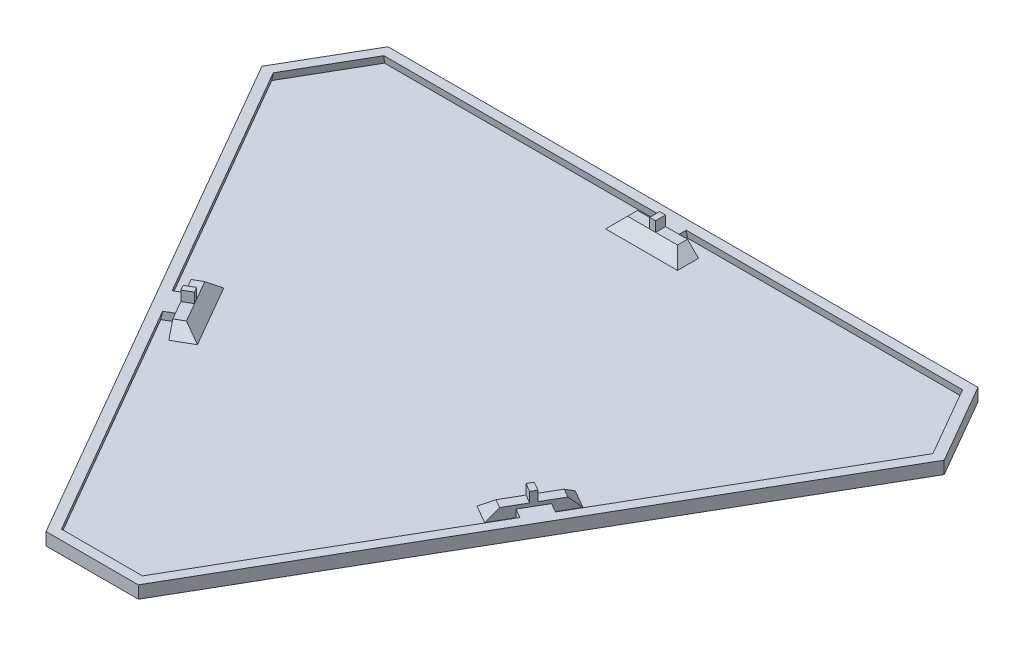
from build123d import *

# Parameters (mm, degrees)
BOSS_EXTRU_2_DEPTH              = 1
EXTRU_MINCE1_DEPTH              = 1.5
EXTRU_MINCE1_DRAFT              = -10
ENL_V_DE_MAT_EXTRU_MINCE1_DEPTH = 101.734373448
ESQUISSE7_W                     = 5.2
ESQUISSE7_H                     = 4.1
BOSS_EXTRU_5_DEPTH              = 1.5
ESQUISSE8_W                     = 10
ESQUISSE8_H                     = 2
BOSS_EXTRU_6_DEPTH              = 2.2
CHANFREIN1_SIZE                 = 2.2
ESQUISSE9_W                     = 1.2
ESQUISSE9_H                     = 2
BOSS_EXTRU_7_DEPTH              = 2


with BuildPart() as part:
    # Esquisse2 → Boss.-Extru.2 (new body)
    with BuildSketch(Plane(origin=(0, 0, 0), x_dir=(1, 0, 0), z_dir=(0, 1, 0))):
        Polygon((-68.262395693, 28.744645862), (-59.024791386, 44.744645862), (59.024791386, 44.744645862), (68.262395693, 28.744645862), (9.237604307, -73.489291724), (-9.237604307, -73.489291724), align=None)
    extrude(amount=BOSS_EXTRU_2_DEPTH)


with BuildPart() as extru_mince1_tool:
    # Esquisse5 → Extru.-Mince1 (with draft: the straight prism first)
    with BuildSketch(Plane(origin=(0, 1, 0), x_dir=(1, 0, 0), z_dir=(0, 1, 0))):
        Polygon((-68.262395693, 28.744645862), (-9.237604307, -73.489291724), (9.237604307, -73.489291724), (68.262395693, 28.744645862), (59.024791386, 44.744645862), (-59.024791386, 44.744645862), align=None)
        Polygon((-66.299404778, 28.744645862), (-8.256108849, -71.789291724), (8.256108849, -71.789291724), (66.299404778, 28.744645862), (58.043295928, 43.044645862), (-58.043295928, 43.044645862), align=None, mode=Mode.SUBTRACT)
    extrude(amount=EXTRU_MINCE1_DEPTH)
    # Extru.-Mince1: the draft: its side faces are tilted about the plane it starts from
    extru_mince1_sides = [extru_mince1_tool.faces().sort_by_distance(p)[0] for p in [
        (-38.75, 1.75, 22.372322931),
        (0, 1.75, 73.489291724),
        (38.75, 1.75, 22.372322931),
        (63.643593539, 1.75, -36.744645862),
        (0, 1.75, -44.744645862),
        (-63.643593539, 1.75, -36.744645862),
        (-62.171350353, 1.75, -35.894645862),
        (0, 1.75, -43.044645862),
        (62.171350353, 1.75, -35.894645862),
        (37.277756814, 1.75, 21.522322931),
        (0, 1.75, 71.789291724),
        (-37.277756814, 1.75, 21.522322931),
    ]]
    draft(extru_mince1_sides, Plane(origin=(0, 1, 0), x_dir=(1, 0, 0), z_dir=(0, 1, 0)), EXTRU_MINCE1_DRAFT)


with BuildPart() as part_1:
    add(part.part)

    # Extru.-Mince1: add extru_mince1_tool
    add(extru_mince1_tool.part)

    # Esquisse6 → Enlèv. de mat.-Extru.-Mince1 (cut, through all)
    with BuildSketch(Plane.XZ):
        Polygon((-59.89081679, -46.244645862), (59.89081679, -46.244645862), (69.994446501, -28.744645862), (10.103629711, 74.989291724), (-10.103629711, 74.989291724), (-69.994446501, -28.744645862), align=None)
        Polygon((-59.024791386, -44.744645862), (59.024791386, -44.744645862), (68.262395693, -28.744645862), (9.237604307, 73.489291724), (-9.237604307, 73.489291724), (-68.262395693, -28.744645862), align=None, mode=Mode.SUBTRACT)
    extrude(amount=-ENL_V_DE_MAT_EXTRU_MINCE1_DEPTH, mode=Mode.SUBTRACT)

    # Esquisse7 → Boss.-Extru.5 (add)
    with BuildSketch(Plane(origin=(0, 1, 0), x_dir=(1, 0, 0), z_dir=(0, 1, 0))):
        with Locations((0, 42.694645862)):
            Rectangle(ESQUISSE7_W, ESQUISSE7_H)
        Polygon((33.899295844, -22.573988981), (36.499295844, -18.070656881), (40.05, -20.120656881), (37.45, -24.623988981), align=None)
        Polygon((-36.499295844, -18.070656881), (-33.899295844, -22.573988981), (-37.45, -24.623988981), (-40.05, -20.120656881), align=None)
    extrude(amount=BOSS_EXTRU_5_DEPTH)

    # Esquisse8 → Boss.-Extru.6 (add)
    with BuildSketch(Plane(origin=(0, 1, 0), x_dir=(1, 0, 0), z_dir=(0, 1, 0))):
        with Locations((0, 39.644645862)):
            Rectangle(ESQUISSE8_W, ESQUISSE8_H)
        Polygon((37.699295844, -15.992195912), (32.699295844, -24.65244995), (30.967245037, -23.65244995), (35.967245037, -14.992195912), align=None)
        Polygon((-32.699295844, -24.65244995), (-37.699295844, -15.992195912), (-35.967245037, -14.992195912), (-30.967245037, -23.65244995), align=None)
    extrude(amount=BOSS_EXTRU_6_DEPTH)

    # Chanfrein1
    chanfrein1_edges = [part_1.edges().sort_by_distance(p)[0] for p in [
        (-31.833270441, 1, 24.15244995),
        (-36.833270441, 1, 15.492195912),
        (-33.467245037, 1, 19.322322931),
        (36.833270441, 1, 15.492195912),
        (33.467245037, 1, 19.322322931),
        (31.833270441, 1, 24.15244995),
        (5, 1, -39.644645862),
        (-5, 1, -39.644645862),
        (0, 1, -38.644645862),
    ]]
    chamfer(chanfrein1_edges, length=CHANFREIN1_SIZE - 0.0001)  # a hair under: the kernel refuses the full size

    # Esquisse9 → Boss.-Extru.7 (add)
    with BuildSketch(Plane(origin=(0, 3.2, 0), x_dir=(1, 0, 0), z_dir=(0, 1, 0))):
        with Locations((0, 39.644645862)):
            Rectangle(ESQUISSE9_W, ESQUISSE9_H)
        Polygon((34.899295844, -20.841938173), (35.499295844, -19.802707689), (33.767245037, -18.802707689), (33.167245037, -19.841938173), align=None)
        Polygon((-35.499295844, -19.802707689), (-34.899295844, -20.841938173), (-33.167245037, -19.841938173), (-33.767245037, -18.802707689), align=None)
    extrude(amount=BOSS_EXTRU_7_DEPTH)


solid = part_1.part
